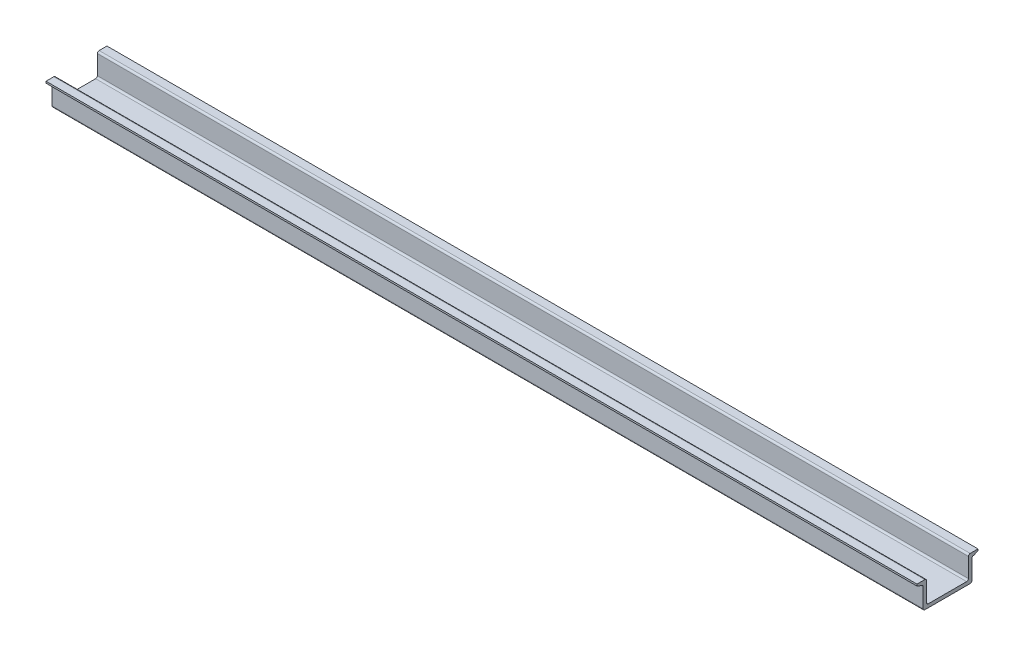
from build123d import *

# Parameters (mm, degrees)
BOSS_EXTRU_1_DEPTH = 500
CONG_1_R           = 1
CHANFREIN1_DEPTH   = 500


with BuildPart() as part:
    # Esquisse1 → Boss.-Extru.1 (new body)
    with BuildSketch(Plane(origin=(0, 0, 0), x_dir=(0, 0, -1), z_dir=(1, 0, 0))):
        Polygon((0, 0), (5.5, 0), (5.5, -13), (29.5, -13), (29.5, 0), (35, 0), (35, -2), (31.5, -2), (31.5, -15), (3.5, -15), (3.5, -2), (0, -2), align=None)
    extrude(amount=BOSS_EXTRU_1_DEPTH)

    # Congé1
    cong_1_edges = [part.edges().sort_by_distance(p)[0] for p in [
        (250, 0, -5.5),
        (250, -13, -5.5),
        (250, -13, -29.5),
        (250, 0, -29.5),
        (250, -2, -31.5),
        (250, -15, -31.5),
        (250, -15, -3.5),
        (250, -2, -3.5),
    ]]
    fillet(cong_1_edges, radius=CONG_1_R)

    # Chanfrein1: read off the stored shape, not the designer's step
    # Chanfrein1 outline → Chanfrein1 (cut)
    with BuildSketch(Plane.YZ):
        with BuildLine():
            Line((-2.001381418, -2.552544532), (-1.002762836, 0))
            Line((-1.002762836, 0), (-2, 0))
            Line((-2, 0), (-2, -2.5))
            ThreePointArc((-2, -2.5), (-2.000345414, -2.526281344), (-2.001381418, -2.552544532))
        make_face()
        with BuildLine():
            Line((-1.002762836, -35), (-2.001381418, -32.447455468))
            ThreePointArc((-2.001381418, -32.447455468), (-2.000345414, -32.473718656), (-2, -32.5))
            Line((-2, -32.5), (-2, -35))
            Line((-2, -35), (-1.002762836, -35))
        make_face()
    extrude(amount=CHANFREIN1_DEPTH, mode=Mode.SUBTRACT)


solid = part.part
